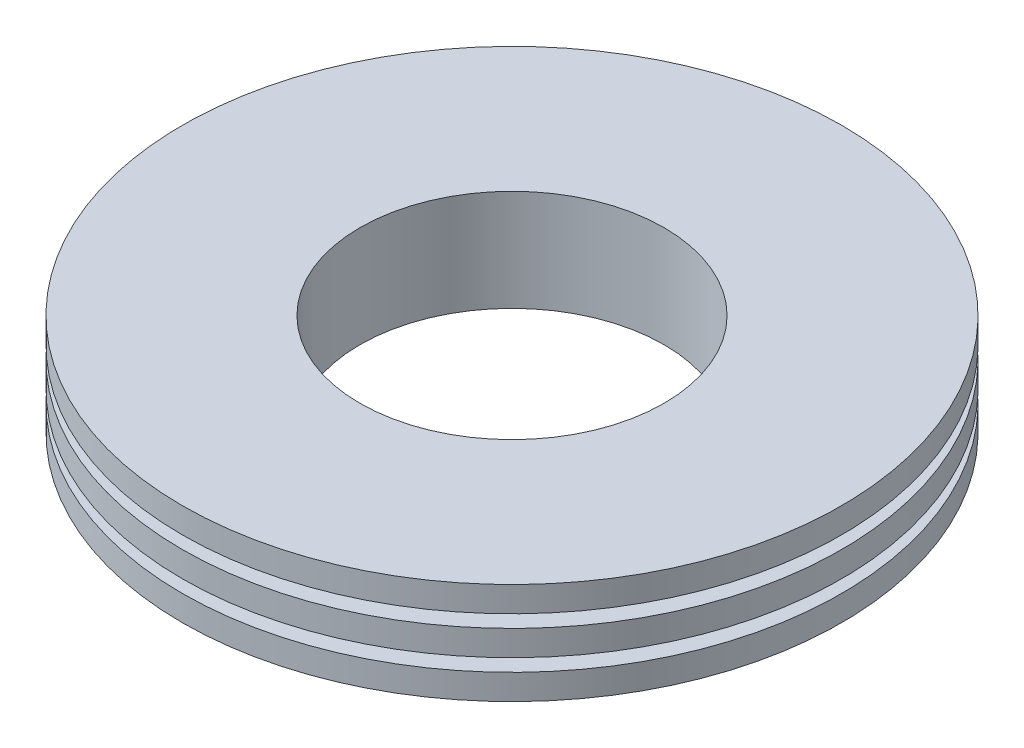
from build123d import *

# Parameters (mm, degrees)
SKETCH_1_R          = 13
EXTRUDE_1_DEPTH     = 4
SKETCH_2_R          = 6
CUT_EXTRUDE_1_DEPTH = 4
CUT_EXTRUDE_START   = -1
SKETCH_3_R          = 13
SKETCH_3_R_2        = 12
CUT_EXTRUDE_2_DEPTH = 0.5
CUT_EXTRUDE_START_2 = -2.5
SKETCH_3_2_R        = 13
SKETCH_3_2_R_2      = 12
CUT_EXTRUDE_3_DEPTH = 0.5


with BuildPart() as part:
    # 草图1 → 凸台-拉伸1 (new body)
    with BuildSketch(Plane(origin=(0, 0, 0), x_dir=(1, 0, 0), z_dir=(0, 1, 0))):
        Circle(SKETCH_1_R)
    extrude(amount=EXTRUDE_1_DEPTH)

    # 草图2 → 切除-拉伸1 (cut)
    with BuildSketch(Plane.XZ):
        Circle(SKETCH_2_R)
    extrude(amount=-CUT_EXTRUDE_1_DEPTH, mode=Mode.SUBTRACT)

    # 草图3 → 切除-拉伸2 (cut)
    with BuildSketch(Plane.XZ.offset(CUT_EXTRUDE_START)):
        Circle(SKETCH_3_R)
        with Locations((0, -0.195897209)):
            Circle(SKETCH_3_R_2, mode=Mode.SUBTRACT)
    extrude(amount=-CUT_EXTRUDE_2_DEPTH, mode=Mode.SUBTRACT)

    # 草图3<2> → 切除-拉伸3 (cut)
    with BuildSketch(Plane.XZ.offset(CUT_EXTRUDE_START_2)):
        Circle(SKETCH_3_2_R)
        with Locations((0, -0.195897209)):
            Circle(SKETCH_3_2_R_2, mode=Mode.SUBTRACT)
    extrude(amount=-CUT_EXTRUDE_3_DEPTH, mode=Mode.SUBTRACT)


solid = part.part
